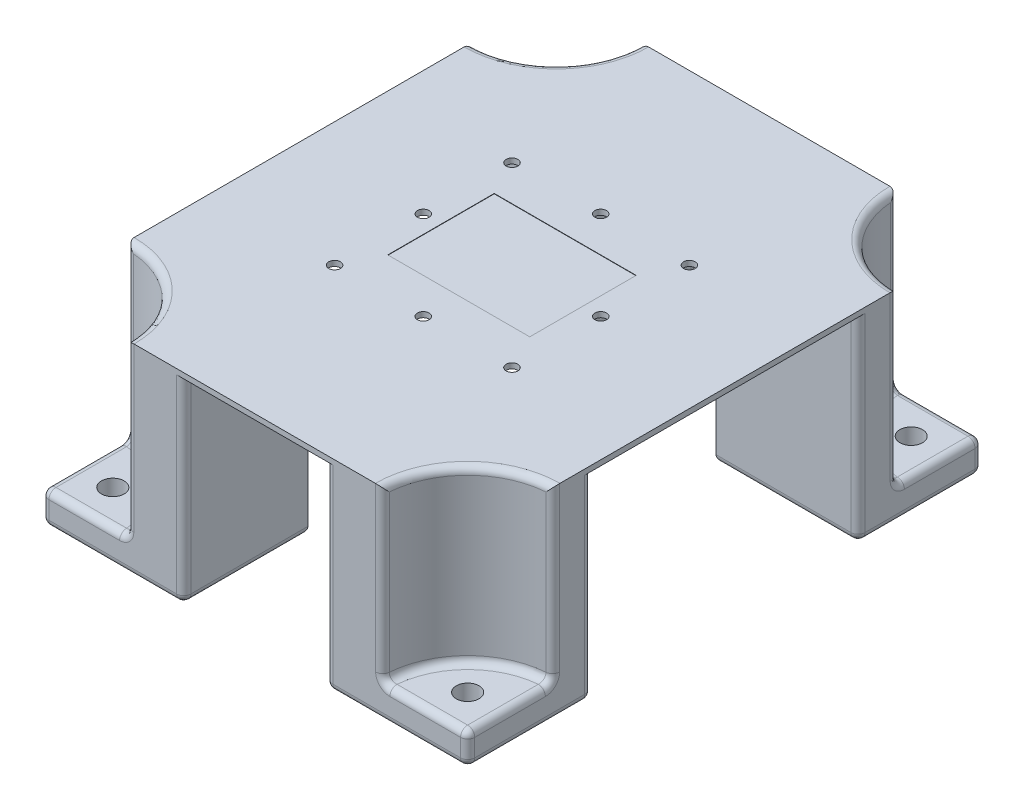
from build123d import *

# Parameters (mm, degrees)
SKETCH1_W             = 40
SKETCH1_H             = 35
BOSS_EXTRUDE1_DEPTH   = 55.5
BOSS_EXTRUDE1_2_DEPTH = 55.5
BOSS_EXTRUDE1_3_DEPTH = 55.5
BOSS_EXTRUDE1_4_DEPTH = 55.5
SKETCH2_W             = 120
SKETCH2_H             = 145
BOSS_EXTRUDE2_DEPTH   = 1.5
CUT_EXTRUDE1_DEPTH    = 48
SKETCH4_R             = 3.2
CUT_EXTRUDE2_DEPTH    = 9
FILLET1_R             = 2
FILLET2_R             = 2
SKETCH5_R             = 1.65
CUT_EXTRUDE3_DEPTH    = 1.5
SKETCH6_W             = 40
SKETCH6_H             = 30
CUT_EXTRUDE4_DEPTH    = 0.1


with BuildPart() as part:
    # Sketch1 → Boss-Extrude1 (new body)
    with BuildSketch(Plane(origin=(0, 0, 0), x_dir=(1, 0, 0), z_dir=(0, 1, 0))):
        with Locations((-40, -55)):
            Rectangle(SKETCH1_W, SKETCH1_H)
    extrude(amount=BOSS_EXTRUDE1_DEPTH)



with BuildPart() as body_2:
    # Sketch1 → Boss-Extrude1 2 (new body)
    with BuildSketch(Plane(origin=(0, 0, 0), x_dir=(1, 0, 0), z_dir=(0, 1, 0))):
        with Locations((40, -55)):
            Rectangle(SKETCH1_W, SKETCH1_H)
    extrude(amount=BOSS_EXTRUDE1_2_DEPTH)


with BuildPart() as body_3:
    # Sketch1 → Boss-Extrude1 3 (new body)
    with BuildSketch(Plane(origin=(0, 0, 0), x_dir=(1, 0, 0), z_dir=(0, 1, 0))):
        with Locations((-40, 55)):
            Rectangle(SKETCH1_W, SKETCH1_H)
    extrude(amount=BOSS_EXTRUDE1_3_DEPTH)


with BuildPart() as body_4:
    # Sketch1 → Boss-Extrude1 4 (new body)
    with BuildSketch(Plane(origin=(0, 0, 0), x_dir=(1, 0, 0), z_dir=(0, 1, 0))):
        with Locations((40, 55)):
            Rectangle(SKETCH1_W, SKETCH1_H)
    extrude(amount=BOSS_EXTRUDE1_4_DEPTH)


with BuildPart() as part_1:
    add(part.part)

    add(body_2.part)  # Boss-Extrude2 merges body 2

    add(body_3.part)  # Boss-Extrude2 merges body 3

    add(body_4.part)  # Boss-Extrude2 merges body 4
    # Sketch2 → Boss-Extrude2 (add)
    with BuildSketch(Plane(origin=(0, 55.5, 0), x_dir=(1, 0, 0), z_dir=(0, 1, 0))):
        Rectangle(SKETCH2_W, SKETCH2_H)
    extrude(amount=BOSS_EXTRUDE2_DEPTH)

    # Sketch3 → Cut-Extrude1 (cut)
    with BuildSketch(Plane(origin=(0, 57, 0), x_dir=(1, 0, 0), z_dir=(0, 1, 0))):
        with BuildLine():
            Line((-60, -48.5), (-60, -72.5))
            Line((-60, -72.5), (-36, -72.5))
            ThreePointArc((-36, -72.5), (-43.029437252, -55.529437252), (-60, -48.5))
        make_face()
        with BuildLine():
            Line((36, -72.5), (60, -72.5))
            Line((60, -72.5), (60, -48.5))
            ThreePointArc((60, -48.5), (43.029437252, -55.529437252), (36, -72.5))
        make_face()
        with BuildLine():
            Line((-60, 72.5), (-60, 48.5))
            ThreePointArc((-60, 48.5), (-43.029437252, 55.529437252), (-36, 72.5))
            Line((-36, 72.5), (-60, 72.5))
        make_face()
        with BuildLine():
            Line((60, 72.5), (36, 72.5))
            ThreePointArc((36, 72.5), (43.029437252, 55.529437252), (60, 48.5))
            Line((60, 48.5), (60, 72.5))
        make_face()
    extrude(amount=-CUT_EXTRUDE1_DEPTH, mode=Mode.SUBTRACT)

    # Sketch4 → Cut-Extrude2 (cut)
    with BuildSketch(Plane(origin=(0, 9, 0), x_dir=(1, 0, 0), z_dir=(0, 1, 0))):
        with Locations(Location((50, -62.5, 0), (0, 0, 270))):
            Circle(SKETCH4_R)
        with Locations(Location((-50, -62.5, 0), (0, 0, 90))):
            Circle(SKETCH4_R)
        with Locations(Location((50, 62.5, 0), (0, 0, 90))):
            Circle(SKETCH4_R)
        with Locations(Location((-50, 62.5, 0), (0, 0, 270))):
            Circle(SKETCH4_R)
    extrude(amount=-CUT_EXTRUDE2_DEPTH, mode=Mode.SUBTRACT)

    # Fillet1
    fillet1_edges = [part_1.edges().sort_by_distance(p)[0] for p in [
        (-60, 0, 55),
        (-40, 0, 72.5),
        (-20, 0, 55),
        (-40, 0, 37.5),
        (-40, 0, -72.5),
        (-60, 0, -55),
        (-40, 0, -37.5),
        (-20, 0, -55),
        (60, 0, 55),
        (40, 0, 37.5),
        (20, 0, 55),
        (40, 0, 72.5),
        (60, 0, -55),
        (40, 0, -37.5),
        (20, 0, -55),
        (-60, 4.5, 72.5),
        (60, 4.5, 72.5),
        (40, 0, -72.5),
        (-60, 4.5, -72.5),
        (60, 4.5, -72.5),
        (60, 9, -60.5),
        (43.029437252, 9, -55.529437252),
        (60, 33, -48.5),
        (48, 9, -72.5),
        (36, 33, -72.5),
        (43.029437252, 57, -55.529437252),
        (-48, 9, 72.5),
        (-36, 33, 72.5),
        (-60, 9, 60.5),
        (-43.029437252, 9, 55.529437252),
        (-60, 33, 48.5),
        (-43.029437252, 57, 55.529437252),
        (-48, 9, -72.5),
        (-43.029437252, 9, -55.529437252),
        (-36, 33, -72.5),
        (-60, 9, -60.5),
        (-60, 33, -48.5),
        (-43.029437252, 57, -55.529437252),
        (43.029437252, 9, 55.529437252),
        (36, 33, 72.5),
        (60, 9, 60.5),
        (60, 33, 48.5),
        (48, 9, 72.5),
        (43.029437252, 57, 55.529437252),
    ]]
    fillet(fillet1_edges, radius=FILLET1_R)

    # Fillet2
    # the kernel refuses this fillet: 2 mm, written as the material it takes off along each edge
    with BuildSketch(Plane(origin=(58, 2, 39.5), x_dir=(0, 0, -1), z_dir=(1, 0, 0))) as fillet2_piece_1_section:
        Polygon((0, 0), (FILLET2_R * 1.02, 0), (FILLET2_R * 1.02, -FILLET2_R * 1.02), (0, -FILLET2_R * 1.02), align=None)
    fillet2_piece_1 = extrude(amount=FILLET2_R * 1.02, mode=Mode.PRIVATE)
    fillet2_piece_1 = fillet2_piece_1 - Plane(origin=(58, 2, 39.5), x_dir=(0, 0.7071067811865475, 0.7071067811865475), z_dir=(1, 0, 0)) * Sphere(FILLET2_R, mode=Mode.PRIVATE)
    add(fillet2_piece_1, mode=Mode.SUBTRACT)
    with BuildSketch(Plane(origin=(22, 2, 70.5), x_dir=(-1, 0, 0), z_dir=(0, 0, 1))) as fillet2_piece_2_section:
        Polygon((0, 0), (FILLET2_R * 1.02, 0), (FILLET2_R * 1.02, FILLET2_R * 1.02), (0, FILLET2_R * 1.02), align=None)
    fillet2_piece_2 = extrude(amount=FILLET2_R * 1.02, mode=Mode.PRIVATE)
    fillet2_piece_2 = fillet2_piece_2 - Plane(origin=(22, 2, 70.5), x_dir=(0.7071067811865475, 0.7071067811865475, 0), z_dir=(0, 0, 1)) * Sphere(FILLET2_R, mode=Mode.PRIVATE)
    add(fillet2_piece_2, mode=Mode.SUBTRACT)
    with BuildSketch(Plane(origin=(-22, 2, 70.5), x_dir=(1, 0, 0), z_dir=(0, 0, 1))) as fillet2_piece_3_section:
        Polygon((0, 0), (FILLET2_R * 1.02, 0), (FILLET2_R * 1.02, -FILLET2_R * 1.02), (0, -FILLET2_R * 1.02), align=None)
    fillet2_piece_3 = extrude(amount=FILLET2_R * 1.02, mode=Mode.PRIVATE)
    fillet2_piece_3 = fillet2_piece_3 - Plane(origin=(-22, 2, 70.5), x_dir=(-0.7071067811865475, 0.7071067811865475, 0), z_dir=(0, 0, 1)) * Sphere(FILLET2_R, mode=Mode.PRIVATE)
    add(fillet2_piece_3, mode=Mode.SUBTRACT)
    with BuildSketch(Plane(origin=(-58, 2, 39.5), x_dir=(-1, 0, 0), z_dir=(0, 0, -1))) as fillet2_piece_4_section:
        Polygon((0, 0), (FILLET2_R * 1.02, 0), (FILLET2_R * 1.02, -FILLET2_R * 1.02), (0, -FILLET2_R * 1.02), align=None)
    fillet2_piece_4 = extrude(amount=FILLET2_R * 1.02, mode=Mode.PRIVATE)
    fillet2_piece_4 = fillet2_piece_4 - Plane(origin=(-58, 2, 39.5), x_dir=(0.7071067811865475, 0.7071067811865475, 0), z_dir=(0, 0, -1)) * Sphere(FILLET2_R, mode=Mode.PRIVATE)
    add(fillet2_piece_4, mode=Mode.SUBTRACT)
    with BuildSketch(Plane(origin=(-58, 2, -39.5), x_dir=(0, 0, 1), z_dir=(-1, 0, 0))) as fillet2_piece_5_section:
        Polygon((0, 0), (FILLET2_R * 1.02, 0), (FILLET2_R * 1.02, -FILLET2_R * 1.02), (0, -FILLET2_R * 1.02), align=None)
    fillet2_piece_5 = extrude(amount=FILLET2_R * 1.02, mode=Mode.PRIVATE)
    fillet2_piece_5 = fillet2_piece_5 - Plane(origin=(-58, 2, -39.5), x_dir=(0, 0.7071067811865475, -0.7071067811865475), z_dir=(-1, 0, 0)) * Sphere(FILLET2_R, mode=Mode.PRIVATE)
    add(fillet2_piece_5, mode=Mode.SUBTRACT)
    with BuildSketch(Plane(origin=(-22, 2, -70.5), x_dir=(0, 0, -1), z_dir=(1, 0, 0))) as fillet2_piece_6_section:
        Polygon((0, 0), (FILLET2_R * 1.02, 0), (FILLET2_R * 1.02, -FILLET2_R * 1.02), (0, -FILLET2_R * 1.02), align=None)
    fillet2_piece_6 = extrude(amount=FILLET2_R * 1.02, mode=Mode.PRIVATE)
    fillet2_piece_6 = fillet2_piece_6 - Plane(origin=(-22, 2, -70.5), x_dir=(0, 0.7071067811865475, 0.7071067811865475), z_dir=(1, 0, 0)) * Sphere(FILLET2_R, mode=Mode.PRIVATE)
    add(fillet2_piece_6, mode=Mode.SUBTRACT)
    with BuildSketch(Plane(origin=(22, 2, -70.5), x_dir=(-1, 0, 0), z_dir=(0, 0, -1))) as fillet2_piece_7_section:
        Polygon((0, 0), (FILLET2_R * 1.02, 0), (FILLET2_R * 1.02, -FILLET2_R * 1.02), (0, -FILLET2_R * 1.02), align=None)
    fillet2_piece_7 = extrude(amount=FILLET2_R * 1.02, mode=Mode.PRIVATE)
    fillet2_piece_7 = fillet2_piece_7 - Plane(origin=(22, 2, -70.5), x_dir=(0.7071067811865475, 0.7071067811865475, 0), z_dir=(0, 0, -1)) * Sphere(FILLET2_R, mode=Mode.PRIVATE)
    add(fillet2_piece_7, mode=Mode.SUBTRACT)
    with BuildSketch(Plane(origin=(58, 2, -39.5), x_dir=(1, 0, 0), z_dir=(0, 0, 1))) as fillet2_piece_8_section:
        Polygon((0, 0), (FILLET2_R * 1.02, 0), (FILLET2_R * 1.02, -FILLET2_R * 1.02), (0, -FILLET2_R * 1.02), align=None)
    fillet2_piece_8 = extrude(amount=FILLET2_R * 1.02, mode=Mode.PRIVATE)
    fillet2_piece_8 = fillet2_piece_8 - Plane(origin=(58, 2, -39.5), x_dir=(-0.7071067811865475, 0.7071067811865475, 0), z_dir=(0, 0, 1)) * Sphere(FILLET2_R, mode=Mode.PRIVATE)
    add(fillet2_piece_8, mode=Mode.SUBTRACT)
    with BuildSketch(Plane(origin=(-60, 2, 37.5), x_dir=(1, 0, 0), z_dir=(0, 1, 0)), Plane(origin=(-20, 2, 72.5), x_dir=(-1, 0, 0), z_dir=(0, 1, 0)), Plane(origin=(-20, 2, -72.5), x_dir=(0, 0, 1), z_dir=(0, 1, 0)), Plane(origin=(-60, 2, -37.5), x_dir=(0, 0, -1), z_dir=(0, 1, 0)), Plane(origin=(60, 2, 37.5), x_dir=(0, 0, 1), z_dir=(0, 1, 0)), Plane(origin=(60, 2, -37.5), x_dir=(-1, 0, 0), z_dir=(0, 1, 0)), Plane(origin=(20, 2, -72.5), x_dir=(1, 0, 0), z_dir=(0, 1, 0))) as fillet2_piece_9:
        with BuildLine():
            CenterArc((FILLET2_R, -FILLET2_R), FILLET2_R, 90, 90)
            Line((0, -FILLET2_R), (0, 0))
            Line((0, 0), (FILLET2_R, 0))
        make_face()
    extrude(amount=53.5, mode=Mode.SUBTRACT)
    with BuildSketch(Plane(origin=(20, 2, 72.5), x_dir=(1, 0, 0), z_dir=(0, 1, 0))) as fillet2_piece_10:
        with BuildLine():
            CenterArc((FILLET2_R, FILLET2_R), FILLET2_R, 180, 90)
            Line((0, FILLET2_R), (0, 0))
            Line((0, 0), (FILLET2_R, 0))
        make_face()
    extrude(amount=53.5, mode=Mode.SUBTRACT)

    # Sketch5 → Cut-Extrude3 (cut)
    with BuildSketch(Plane(origin=(0, 57, 0), x_dir=(1, 0, 0), z_dir=(0, 1, 0))):
        with Locations(Location((25, -25, 0), (0, 0, 270))):
            Circle(SKETCH5_R)
        with Locations(Location((0, -25, 0), (0, 0, 270))):
            Circle(SKETCH5_R)
        with Locations(Location((-25, -25, 0), (0, 0, 270))):
            Circle(SKETCH5_R)
        with Locations(Location((-25, 0, 0), (0, 0, 270))):
            Circle(SKETCH5_R)
        with Locations(Location((0, 25, 0), (0, 0, 270))):
            Circle(SKETCH5_R)
        with Locations(Location((-25, 25, 0), (0, 0, 270))):
            Circle(SKETCH5_R)
        with Locations(Location((25, 0, 0), (0, 0, 270))):
            Circle(SKETCH5_R)
        with Locations(Location((25, 25, 0), (0, 0, 270))):
            Circle(SKETCH5_R)
    extrude(amount=-CUT_EXTRUDE3_DEPTH, mode=Mode.SUBTRACT)

    # Sketch6 → Cut-Extrude4 (cut)
    with BuildSketch(Plane(origin=(0, 57, 0), x_dir=(1, 0, 0), z_dir=(0, 1, 0))):
        Rectangle(SKETCH6_W, SKETCH6_H)
    extrude(amount=-CUT_EXTRUDE4_DEPTH, mode=Mode.SUBTRACT)


solid = part_1.part
